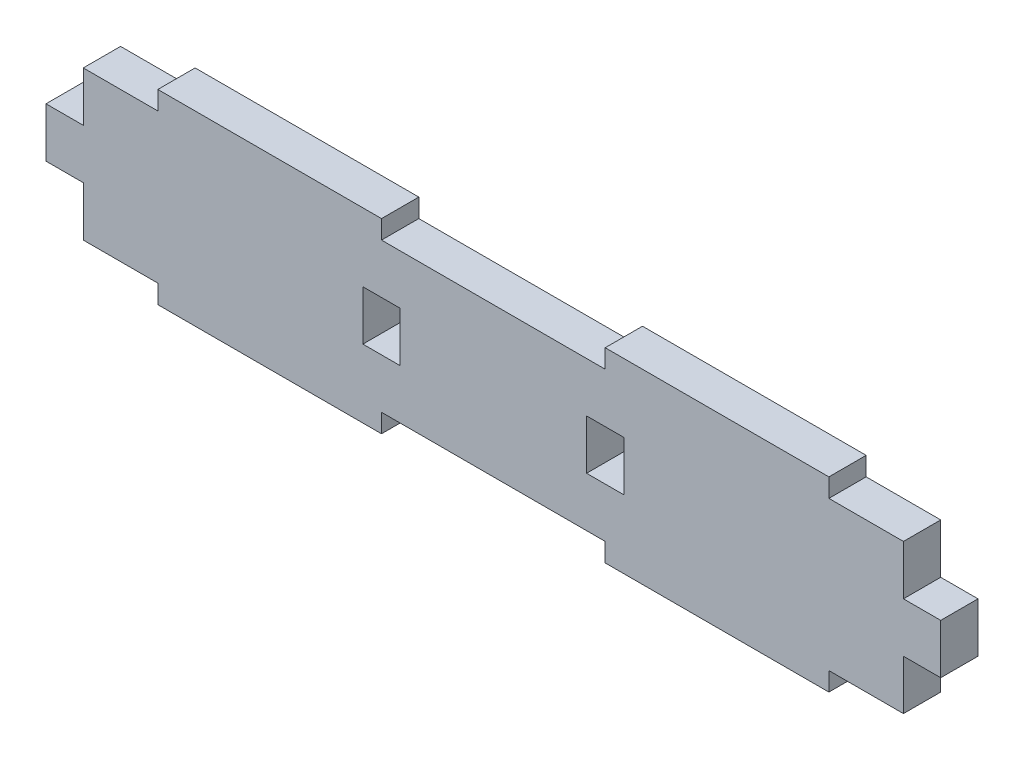
from build123d import *

# Parameters (mm, degrees)
SKETCH1_W           = 304.8
SKETCH1_H           = 50.8
BOSS_EXTRUDE1_DEPTH = 12.7
SKETCH2_W           = 76.2
SKETCH2_H           = 6.35
BOSS_EXTRUDE2_DEPTH = 12.7
SKETCH3_W           = 12.7
SKETCH3_H           = 16.933333333
SKETCH3_H_2         = 16.933333334
CUT_EXTRUDE1_DEPTH  = 157.189348228


with BuildPart() as part:
    # Sketch1 → Boss-Extrude1 (new body)
    with BuildSketch(Plane.XY):
        Rectangle(SKETCH1_W, SKETCH1_H)
    extrude(amount=BOSS_EXTRUDE1_DEPTH)

    # Sketch2 → Boss-Extrude2 (add)
    with BuildSketch(Plane.XY.offset(12.7)):
        with Locations((-76.2, -28.575)):
            Rectangle(SKETCH2_W, SKETCH2_H)
        with Locations((76.2, -28.575)):
            Rectangle(SKETCH2_W, SKETCH2_H)
        with Locations((76.2, 28.575)):
            Rectangle(SKETCH2_W, SKETCH2_H)
        with Locations((-76.2, 28.575)):
            Rectangle(SKETCH2_W, SKETCH2_H)
    extrude(amount=-BOSS_EXTRUDE2_DEPTH)

    # Sketch3 → Cut-Extrude1 (cut, through all)
    with BuildSketch(Plane.XY.offset(12.7)):
        with Locations((-146.05, -16.933333334)):
            Rectangle(SKETCH3_W, SKETCH3_H)
        with Locations((-146.05, 16.933333334)):
            Rectangle(SKETCH3_W, SKETCH3_H)
        with Locations((146.05, 16.933333334)):
            Rectangle(SKETCH3_W, SKETCH3_H)
        with Locations((146.05, -16.933333334)):
            Rectangle(SKETCH3_W, SKETCH3_H)
        with Locations((38.1, 0)):
            Rectangle(SKETCH3_W, SKETCH3_H_2)
        with Locations((-38.1, 0)):
            Rectangle(SKETCH3_W, SKETCH3_H_2)
    extrude(amount=-CUT_EXTRUDE1_DEPTH, mode=Mode.SUBTRACT)


solid = part.part
